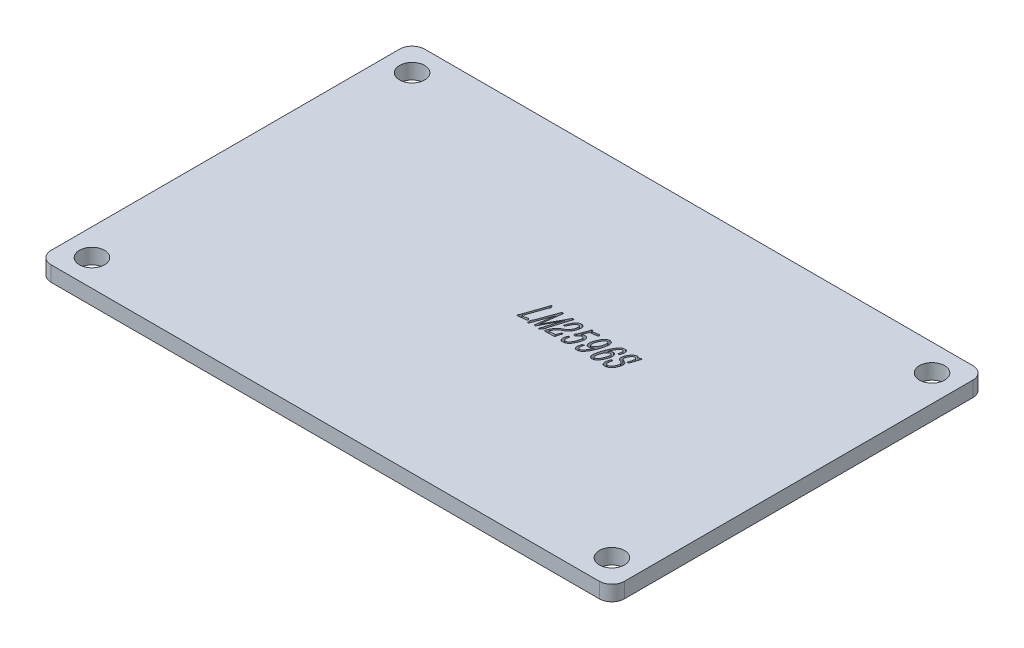
from build123d import *

# Parameters (mm, degrees)
SKETCH_1_R          = 1.65
EXTRUDE_1_DEPTH     = 2
CUT_EXTRUDE_START   = -1
CUT_EXTRUDE_1_DEPTH = 1


# Read off the part's stored shape, not the designer's step: 切除-拉伸1
with BuildPart() as part:
    # 草图1 → 凸台-拉伸1 (new body)
    with BuildSketch(Plane(origin=(0, 0, 0), x_dir=(1, 0, 0), z_dir=(0, 1, 0))):
        with BuildLine():
            Line((35.95, -24.5), (-35.95, -24.5))
            ThreePointArc((-35.95, -24.5), (-37.116726189, -24.016726189), (-37.6, -22.85))
            Line((-37.6, -22.85), (-37.6, 22.85))
            ThreePointArc((-37.6, 22.85), (-37.116726189, 24.016726189), (-35.95, 24.5))
            Line((-35.95, 24.5), (35.95, 24.5))
            ThreePointArc((35.95, 24.5), (37.116726189, 24.016726189), (37.6, 22.85))
            Line((37.6, 22.85), (37.6, -22.85))
            ThreePointArc((37.6, -22.85), (37.116726189, -24.016726189), (35.95, -24.5))
        make_face()
        with Locations(Location((-34.1, 21, 0), (0, 0, 270))):
            Circle(SKETCH_1_R, mode=Mode.SUBTRACT)
        with Locations(Location((34.1, 21, 0), (0, 0, 90))):
            Circle(SKETCH_1_R, mode=Mode.SUBTRACT)
        with Locations(Location((34.1, -21, 0), (0, 0, 270))):
            Circle(SKETCH_1_R, mode=Mode.SUBTRACT)
        with Locations(Location((-34.1, -21, 0), (0, 0, 90))):
            Circle(SKETCH_1_R, mode=Mode.SUBTRACT)
    extrude(amount=EXTRUDE_1_DEPTH)

    # 切除-拉伸1 outline → 切除-拉伸1 (cut)
    # profile 1 of 7: a face of its own
    with BuildSketch(Plane(origin=(0, 2, 0), x_dir=(1, 0, 0), z_dir=(0, 1, 0)).offset(CUT_EXTRUDE_START)):
        with BuildLine():
            add(Edge.make_bspline(
                [(11.319624973, 2.529725123), (11.326753338, 2.567830624), (11.339981513, 2.638543373), (11.363810052, 2.738810386), (11.386747264, 2.83309971), (11.402493277, 2.928406503), (11.408788686, 3.024022456), (11.40107061, 3.101456515), (11.384715065, 3.156938358), (11.369804851, 3.194089384), (11.348293758, 3.225207318), (11.322963493, 3.250684221), (11.294296694, 3.270288272), (11.263524636, 3.284015152), (11.230211949, 3.291074833), (11.184684427, 3.290006717), (11.129135658, 3.280496298), (11.076013715, 3.25837237), (11.034406929, 3.229718869), (10.996101664, 3.199008787), (10.95262477, 3.156252878), (10.901523079, 3.105345591), (10.847119389, 3.043543935), (10.792558439, 2.971198575), (10.736915044, 2.889534868), (10.664019856, 2.766635878), (10.576158329, 2.602847504), (10.499771775, 2.433051534), (10.445727973, 2.301323215), (10.421585689, 2.239116022), (10.410345271, 2.210525074)],
                knots=[0, 0, 0, 0, 0.048016888, 0.089105405, 0.127654772, 0.168210064, 0.208611881, 0.246125029, 0.263765638, 0.280183723, 0.295474126, 0.310282398, 0.324462469, 0.338252576, 0.351782306, 0.366256964, 0.394408992, 0.421179489, 0.436725185, 0.456877911, 0.481929832, 0.512200465, 0.546242109, 0.583815889, 0.624389886, 0.668597469, 0.76077153, 0.854490538, 0.899099648, 0.93715592, 0.93715592, 0.93715592, 0.93715592], degree=3))
            Line((11.319624973, 2.529725123), (11.486682293, 2.553590454))
            Line((11.486682293, 2.553590454), (11.542616663, 2.577455785))
            Line((11.542616663, 2.577455785), (11.59705945, 2.735563605))
            add(Edge.make_bspline(
                [(11.300980183, 3.558171745), (11.332938296, 3.55537961), (11.391604224, 3.55025405), (11.470752634, 3.530082967), (11.533066183, 3.499358127), (11.576123996, 3.457009642), (11.604543879, 3.412414193), (11.628279189, 3.371220088), (11.645918441, 3.332653625), (11.656575541, 3.294841352), (11.663922251, 3.255421395), (11.665904063, 3.210409655), (11.667264725, 3.158391127), (11.663279952, 3.101732242), (11.660194196, 3.045264039), (11.655589125, 2.993299452), (11.650667761, 2.948240187), (11.642153035, 2.894323663), (11.626748851, 2.823432882), (11.607663016, 2.766946106), (11.59705945, 2.735563605)],
                knots=[0, 0, 0, 0, 0.091586168, 0.168125935, 0.232336966, 0.287622003, 0.338278218, 0.383145194, 0.423552602, 0.459085297, 0.495189033, 0.537922916, 0.587673765, 0.643887342, 0.700141333, 0.749361491, 0.792995872, 0.829682411, 0.905376226, 1, 1, 1, 1], degree=3))
            add(Edge.make_bspline(
                [(10.078627743, 2.088962284), (10.092043775, 2.124514194), (10.117212009, 2.191208933), (10.152737815, 2.284990134), (10.185663794, 2.365405537), (10.225197569, 2.458460171), (10.279164702, 2.571015442), (10.346529938, 2.7098071), (10.422825779, 2.84851108), (10.4891655, 2.962189864), (10.547655064, 3.05014134), (10.597371436, 3.11763489), (10.654008389, 3.186987801), (10.714203242, 3.258491084), (10.779252353, 3.326433394), (10.846166624, 3.388282473), (10.915212273, 3.440367594), (10.984767437, 3.48551032), (11.058000786, 3.520567517), (11.135394035, 3.544224908), (11.216917438, 3.558489113), (11.272581603, 3.55827896), (11.300980183, 3.558171745)],
                knots=[0, 0, 0, 0, 0.056410835, 0.105825706, 0.14886341, 0.185400755, 0.255897094, 0.334127727, 0.414387224, 0.490842857, 0.529430594, 0.571134342, 0.615225599, 0.662339254, 0.709844425, 0.754777107, 0.797439761, 0.838085033, 0.877703722, 0.91750761, 0.957914275, 1, 1, 1, 1], degree=3))
            add(Edge.make_bspline(
                [(10.220328148, 0.281909227), (10.19249915, 0.280098745), (10.138454152, 0.276582721), (10.070837234, 0.287224422), (10.020300058, 0.307853057), (9.981584961, 0.329435729), (9.942445068, 0.358703245), (9.902806204, 0.393420868), (9.86591267, 0.435175841), (9.837901593, 0.485120934), (9.814521026, 0.539843172), (9.797351744, 0.623039326), (9.785413991, 0.73268396), (9.780797995, 0.847487699), (9.785600824, 0.948152915), (9.796865384, 1.037662616), (9.813201733, 1.140700776), (9.835695491, 1.251967632), (9.860700878, 1.361489032), (9.881452444, 1.45999998), (9.901360112, 1.541057249), (9.921795449, 1.627581379), (9.950036536, 1.724331764), (9.987162506, 1.839703457), (10.030604097, 1.961317245), (10.06209135, 2.045009175), (10.078627743, 2.088962284)],
                knots=[0, 0, 0, 0, 0.03956068, 0.07682838, 0.095843058, 0.116866224, 0.139607214, 0.165118082, 0.191658894, 0.218244295, 0.246111869, 0.275832629, 0.33841793, 0.402715898, 0.438774703, 0.481433334, 0.530775575, 0.586935239, 0.642621152, 0.690341085, 0.729908068, 0.761166336, 0.816603174, 0.872993246, 0.933298924, 1, 1, 1, 1], degree=3))
            add(Edge.make_bspline(
                [(11.068293203, 1.084380993), (11.053872372, 1.05541355), (11.023329038, 0.994060479), (10.969919402, 0.900045656), (10.909148123, 0.797266792), (10.842698841, 0.689580228), (10.77067729, 0.585020153), (10.689912589, 0.496193855), (10.604071033, 0.425272911), (10.514549478, 0.373835141), (10.428409541, 0.337241697), (10.350739054, 0.30914977), (10.282885658, 0.289066112), (10.239814747, 0.284138589), (10.220328148, 0.281909227)],
                knots=[0, 0, 0, 0, 0.079263847, 0.167880907, 0.264814542, 0.371790082, 0.477921398, 0.575347443, 0.664953156, 0.749565857, 0.827301008, 0.893958514, 0.952023584, 1, 1, 1, 1], degree=3))
            add(Edge.make_bspline(
                [(10.866929469, 2.42158534), (10.886589109, 2.42118425), (10.924292828, 2.420415029), (10.978317607, 2.413823439), (11.027127036, 2.402341257), (11.0704245, 2.384465457), (11.110126107, 2.363025804), (11.145250427, 2.334657677), (11.177822239, 2.301762803), (11.206196623, 2.262416031), (11.230840866, 2.217275717), (11.251560663, 2.166182107), (11.268932178, 2.109090825), (11.285125994, 2.024054569), (11.296537056, 1.911174741), (11.289262569, 1.794565371), (11.274634537, 1.697461188), (11.256960519, 1.617881049), (11.23389369, 1.53225165), (11.19483815, 1.411518301), (11.141690833, 1.260480826), (11.092451101, 1.142342016), (11.068293203, 1.084380993)],
                knots=[0, 0, 0, 0, 0.036382012, 0.069774277, 0.100580197, 0.128866596, 0.156266865, 0.183794371, 0.212106964, 0.241746136, 0.273258923, 0.307101626, 0.343643368, 0.383535045, 0.467197852, 0.552918689, 0.598998486, 0.648914818, 0.703726948, 0.763108811, 0.883776925, 1, 1, 1, 1], degree=3))
            add(Edge.make_bspline(
                [(10.410345271, 2.210525074), (10.416050186, 2.215819905), (10.449129723, 2.245792172), (10.515387249, 2.296635031), (10.596944633, 2.34739101), (10.669961017, 2.38141985), (10.730958103, 2.401452348), (10.797361446, 2.414729849), (10.843260597, 2.419252922), (10.866929469, 2.42158534)],
                knots=[0.404971471, 0.404971471, 0.404971471, 0.404971471, 0.432023627, 0.560128766, 0.694717093, 0.765101066, 0.83971451, 0.917345382, 1, 1, 1, 1], degree=3))
        make_face()
        with BuildLine():
            add(Edge.make_bspline(
                [(10.78340081, 2.144150863), (10.773100017, 2.142556458), (10.750618648, 2.139076688), (10.716027357, 2.124014401), (10.676728769, 2.104229335), (10.61950773, 2.068122267), (10.549209543, 2.014286204), (10.485947564, 1.949276583), (10.438225331, 1.889966685), (10.402168059, 1.836055129), (10.362124324, 1.775401551), (10.32250004, 1.70543497), (10.282350459, 1.628120598), (10.242879966, 1.544201096), (10.20537119, 1.453333549), (10.182767084, 1.390009052), (10.171105902, 1.35734072)],
                knots=[0, 0, 0, 0, 0.030109941, 0.065714622, 0.108588335, 0.157792871, 0.261597461, 0.364557771, 0.419941904, 0.482122806, 0.552499195, 0.630638236, 0.715103682, 0.805067532, 0.89943673, 1, 1, 1, 1], degree=3))
            add(Edge.make_bspline(
                [(10.994459834, 1.706371191), (10.996023434, 1.727987763), (10.999094338, 1.770442601), (10.998155227, 1.83301138), (10.993304701, 1.893197713), (10.982810117, 1.949506966), (10.969352689, 2.000724278), (10.95159455, 2.044118522), (10.930889814, 2.079967855), (10.905013561, 2.106412307), (10.876785311, 2.125274258), (10.847149319, 2.138714329), (10.815442897, 2.144403173), (10.79410278, 2.144235134), (10.78340081, 2.144150863)],
                knots=[0, 0, 0, 0, 0.117814531, 0.231387145, 0.339957123, 0.445764662, 0.542521874, 0.627383564, 0.700188791, 0.766158301, 0.826528991, 0.884046869, 0.941850039, 1, 1, 1, 1], degree=3))
            add(Edge.make_bspline(
                [(10.261346687, 0.559343703), (10.277116988, 0.561036132), (10.310050452, 0.564570469), (10.359697313, 0.581371719), (10.411370211, 0.606364875), (10.464387545, 0.639656708), (10.516258175, 0.68049559), (10.566448783, 0.725344467), (10.611522599, 0.776372283), (10.667831669, 0.851112799), (10.731329902, 0.95619793), (10.795934626, 1.094643622), (10.855107472, 1.241413379), (10.915663077, 1.390752272), (10.967307612, 1.545247184), (10.985397457, 1.652594138), (10.994459834, 1.706371191)],
                knots=[0, 0, 0, 0, 0.033065291, 0.069050969, 0.108790502, 0.152905102, 0.19956824, 0.246646067, 0.293375687, 0.341592316, 0.442107469, 0.549241177, 0.660589479, 0.772799957, 0.88618076, 1, 1, 1, 1], degree=3))
            add(Edge.make_bspline(
                [(10.171105902, 1.35734072), (10.157214891, 1.313537581), (10.128946777, 1.22439849), (10.099911739, 1.087160277), (10.082936778, 0.949425392), (10.081717538, 0.837543122), (10.089357472, 0.754881106), (10.09924336, 0.701098577), (10.115046922, 0.655622102), (10.133766577, 0.617106754), (10.158955138, 0.587815623), (10.18889873, 0.567377888), (10.224199621, 0.557126412), (10.248618264, 0.55858395), (10.261346687, 0.559343703)],
                knots=[0, 0, 0, 0, 0.152325287, 0.309980926, 0.464393534, 0.611968529, 0.679892627, 0.739554139, 0.792740957, 0.839202455, 0.880695047, 0.919337794, 0.957954149, 1, 1, 1, 1], degree=3))
        make_face(mode=Mode.SUBTRACT)
    # profile 2 of 7: a face of its own
    with BuildSketch(Plane(origin=(0, 2, 0), x_dir=(1, 0, 0), z_dir=(0, 1, 0)).offset(CUT_EXTRUDE_START)):
        with BuildLine():
            add(Edge.make_bspline(
                [(12.912635841, 3.567867036), (12.939142799, 3.565233706), (12.990134196, 3.560167972), (13.061479373, 3.539212889), (13.125736341, 3.511504093), (13.179321881, 3.472634465), (13.224573033, 3.431830655), (13.258620007, 3.394250591), (13.275885689, 3.369629077), (13.28190395, 3.359344784)],
                knots=[0, 0, 0, 0, 0.160913397, 0.309548871, 0.448301289, 0.582320695, 0.708056454, 0.8167907, 0.888918404, 0.888918404, 0.888918404, 0.888918404], degree=3))
            add(Edge.make_bspline(
                [(12.028872789, 2.730343064), (12.037961875, 2.756585471), (12.05554781, 2.807360352), (12.086989767, 2.878979592), (12.11750693, 2.945449357), (12.162163511, 3.025869263), (12.224268655, 3.12064819), (12.306016893, 3.227829835), (12.393614077, 3.323941803), (12.484290088, 3.405999762), (12.578963013, 3.471260438), (12.661240331, 3.516590821), (12.73159073, 3.543940104), (12.788797484, 3.557595487), (12.849411885, 3.567266944), (12.891215329, 3.567663723), (12.912635841, 3.567867036)],
                knots=[0, 0, 0, 0, 0.064498195, 0.12479374, 0.181637338, 0.234373753, 0.338350867, 0.444636662, 0.547250782, 0.640116115, 0.728083073, 0.81387459, 0.857749845, 0.902998931, 0.950295664, 1, 1, 1, 1], degree=3))
            add(Edge.make_bspline(
                [(12.213829107, 1.920413382), (12.18380199, 1.935425676), (12.124665966, 1.964991197), (12.061289845, 2.0182297), (12.019942917, 2.06725959), (11.994543204, 2.10732764), (11.973202676, 2.150129614), (11.957629324, 2.196825794), (11.947181788, 2.247139404), (11.942356007, 2.301149805), (11.941503127, 2.358766382), (11.94621769, 2.42089776), (11.956966845, 2.488708612), (11.974384709, 2.5631426), (11.998467725, 2.64475035), (12.018397516, 2.700854323), (12.028872789, 2.730343064)],
                knots=[0, 0, 0, 0, 0.107404064, 0.211523776, 0.262460483, 0.312661898, 0.363291962, 0.415479857, 0.470049255, 0.527721881, 0.589115285, 0.654664533, 0.727279933, 0.809086455, 0.899654161, 1, 1, 1, 1], degree=3))
            Line((12.213829107, 1.920413382), (12.398039633, 1.841359472))
            add(Edge.make_bspline(
                [(12.585233326, 1.240251438), (12.594400313, 1.274448647), (12.611296104, 1.33747796), (12.62795106, 1.425432934), (12.636008327, 1.498379763), (12.633269717, 1.558239262), (12.622779176, 1.608147262), (12.608581966, 1.652170455), (12.587575031, 1.690922305), (12.562719839, 1.726194961), (12.531116406, 1.757888149), (12.493380693, 1.787946863), (12.448445071, 1.816124798), (12.415345898, 1.832695368), (12.398039633, 1.841359472)],
                knots=[0, 0, 0, 0, 0.149796169, 0.276091238, 0.378589772, 0.459715849, 0.528429664, 0.593977199, 0.65469369, 0.714259707, 0.776015707, 0.843387247, 0.918113307, 1, 1, 1, 1], degree=3))
            add(Edge.make_bspline(
                [(11.931174089, 0.574259535), (11.95160895, 0.574956763), (11.991801323, 0.576328107), (12.050331783, 0.58771282), (12.10533799, 0.6066983), (12.15778136, 0.632425154), (12.207284117, 0.665796263), (12.256453349, 0.704089904), (12.304001843, 0.748899201), (12.363583365, 0.815241572), (12.430281098, 0.898970165), (12.494124356, 1.005113843), (12.545134858, 1.117985543), (12.571358469, 1.197945037), (12.585233326, 1.240251438)],
                knots=[0, 0, 0, 0, 0.06157663, 0.121112194, 0.178948509, 0.236604839, 0.296685232, 0.358612133, 0.424367126, 0.493341319, 0.627383728, 0.746417103, 0.865829817, 1, 1, 1, 1], degree=3))
            add(Edge.make_bspline(
                [(11.776795227, 1.46398892), (11.768461383, 1.425980908), (11.752797092, 1.354541058), (11.732683638, 1.253544708), (11.716322288, 1.165770154), (11.699399386, 1.069455772), (11.687113395, 0.964430817), (11.688733634, 0.867064956), (11.697142974, 0.79769926), (11.708995673, 0.75251395), (11.722406268, 0.711364334), (11.740619482, 0.675611471), (11.760390674, 0.644836582), (11.782109829, 0.620379129), (11.803881566, 0.600607911), (11.835200511, 0.58383917), (11.878312409, 0.573425255), (11.913231895, 0.573976366), (11.931174089, 0.574259535)],
                knots=[0, 0, 0, 0, 0.112864024, 0.212139198, 0.298694179, 0.371837857, 0.495825715, 0.604731979, 0.653479027, 0.698076056, 0.740035884, 0.7787337, 0.814133331, 0.845812142, 0.873421557, 0.898915982, 0.948061405, 1, 1, 1, 1], degree=3))
            Line((11.776795227, 1.46398892), (11.570956744, 1.46398892))
            Line((11.570956744, 1.46398892), (11.482207543, 1.151502237))
            add(Edge.make_bspline(
                [(11.846153846, 0.291604517), (11.821507506, 0.291672515), (11.774402182, 0.291802474), (11.707229629, 0.302668781), (11.647908365, 0.323792617), (11.596166803, 0.353871173), (11.552693807, 0.393226045), (11.514008461, 0.437883281), (11.483088935, 0.490364957), (11.45641734, 0.548064989), (11.437405549, 0.612114312), (11.425614494, 0.681715451), (11.420595756, 0.756164709), (11.423124823, 0.861840183), (11.43937617, 0.995682807), (11.468003001, 1.099826479), (11.482207543, 1.151502237)],
                knots=[0, 0, 0, 0, 0.066209553, 0.126543031, 0.181941951, 0.234679622, 0.286308345, 0.338948483, 0.392946326, 0.449486953, 0.509545765, 0.57196873, 0.638979959, 0.709851081, 0.856029028, 1, 1, 1, 1], degree=3))
            add(Edge.make_bspline(
                [(12.716492649, 0.886746218), (12.690673631, 0.843535161), (12.639155802, 0.757314228), (12.560012956, 0.660765442), (12.494157344, 0.590048647), (12.446439371, 0.542235389), (12.400473609, 0.499550612), (12.354670103, 0.462173232), (12.307160045, 0.427820804), (12.25390394, 0.397983566), (12.195658355, 0.36856258), (12.132248815, 0.342013207), (12.064574224, 0.319473968), (11.993939972, 0.303210907), (11.920780395, 0.293064213), (11.871295667, 0.292096292), (11.846153846, 0.291604517)],
                knots=[0, 0, 0, 0, 0.136340092, 0.272045418, 0.337393071, 0.398407192, 0.455181305, 0.507402547, 0.558653188, 0.613922574, 0.672710074, 0.735558621, 0.800150866, 0.865886795, 0.931860792, 1, 1, 1, 1], degree=3))
            add(Edge.make_bspline(
                [(12.603878116, 2.121777115), (12.625624731, 2.110055924), (12.666928449, 2.087793665), (12.723661478, 2.052989545), (12.771789988, 2.018606704), (12.823834543, 1.974915948), (12.876279106, 1.915606015), (12.913094756, 1.847682595), (12.93267358, 1.790038621), (12.943825739, 1.74470064), (12.947642368, 1.696750531), (12.947439011, 1.629122814), (12.93803875, 1.540489915), (12.922539072, 1.449199842), (12.903377024, 1.372394865), (12.887292499, 1.308688575), (12.865934129, 1.241147333), (12.835749131, 1.144635294), (12.79080682, 1.023351055), (12.741226002, 0.932211244), (12.716492649, 0.886746218)],
                knots=[0, 0, 0, 0, 0.051978856, 0.098724335, 0.139954766, 0.176325786, 0.241579757, 0.305248117, 0.337342347, 0.369572714, 0.403199264, 0.438248371, 0.511800373, 0.590407898, 0.632912887, 0.678337143, 0.72864387, 0.781914954, 0.891208439, 1, 1, 1, 1], degree=3))
            Line((12.603878116, 2.121777115), (12.451736629, 2.191881526))
            add(Edge.make_bspline(
                [(12.251864479, 2.420839548), (12.25546024, 2.402259087), (12.262116354, 2.367864795), (12.280672021, 2.321957054), (12.302840436, 2.284124567), (12.341964771, 2.250166174), (12.392119568, 2.220779682), (12.432728901, 2.201095135), (12.451736629, 2.191881526)],
                knots=[0, 0, 0, 0, 0.175867707, 0.325548712, 0.459851584, 0.579514817, 0.803186428, 1, 1, 1, 1], degree=3))
            add(Edge.make_bspline(
                [(12.827615598, 3.290432559), (12.817908102, 3.289873934), (12.796811475, 3.288659913), (12.768800737, 3.283484538), (12.742880056, 3.273587179), (12.717635925, 3.261203579), (12.687516093, 3.243071278), (12.638434899, 3.211799257), (12.573729795, 3.160269146), (12.503974029, 3.081081866), (12.440608573, 2.992377615), (12.393744172, 2.913555877), (12.361985839, 2.845783376), (12.33736252, 2.789834611), (12.312076152, 2.727980931), (12.287128503, 2.662429917), (12.266514629, 2.596339869), (12.252249856, 2.533358423), (12.24732849, 2.475025625), (12.250408657, 2.438230529), (12.251864479, 2.420839548)],
                knots=[0, 0, 0, 0, 0.02615902, 0.056849589, 0.07610501, 0.100631584, 0.132403363, 0.17061691, 0.257201114, 0.353786648, 0.453453338, 0.550260886, 0.599916659, 0.654714876, 0.714699339, 0.779666327, 0.843339964, 0.900791803, 0.953109843, 1, 1, 1, 1], degree=3))
            add(Edge.make_bspline(
                [(13.052844662, 2.761666312), (13.058173498, 2.789455577), (13.067940833, 2.840391112), (13.076337384, 2.910439693), (13.082173791, 2.966656911), (13.080289229, 3.022987276), (13.06815402, 3.08223188), (13.044263646, 3.146477292), (13.006166289, 3.203274921), (12.955389906, 3.248171568), (12.895185746, 3.281983749), (12.850160063, 3.287613653), (12.827615598, 3.290432559)],
                knots=[0, 0, 0, 0, 0.128213972, 0.235006107, 0.319796701, 0.384071856, 0.489716169, 0.592471914, 0.693117255, 0.796064391, 0.897888965, 1, 1, 1, 1], degree=3))
            Line((13.052844662, 2.761666312), (12.895482634, 2.19859365))
            Line((12.895482634, 2.19859365), (13.099083742, 2.211272107))
            Line((13.099083742, 2.211272107), (13.553270829, 3.524611123))
            Line((13.553270829, 3.524611123), (13.373535052, 3.539526955))
            Line((13.373535052, 3.539526955), (13.28190395, 3.359344784))
        make_face()
    # profile 3 of 7: a face of its own
    with BuildSketch(Plane(origin=(0, 2, 0), x_dir=(1, 0, 0), z_dir=(0, 1, 0)).offset(CUT_EXTRUDE_START)):
        with BuildLine():
            add(Edge.make_bspline(
                [(4.518751332, 2.1941189), (4.52742417, 2.224704013), (4.543586905, 2.281702542), (4.56654992, 2.361132264), (4.587435472, 2.42793498), (4.611929362, 2.503501881), (4.646526277, 2.594316086), (4.67664378, 2.666295228), (4.692520776, 2.704240358)],
                knots=[0, 0, 0, 0, 0.176806308, 0.329496897, 0.459810584, 0.566052454, 0.77123656, 1, 1, 1, 1], degree=3))
            Line((4.518751332, 2.1941189), (4.694012359, 2.217984232))
            Line((4.694012359, 2.217984232), (4.748455146, 2.241103772))
            Line((4.748455146, 2.241103772), (4.808118474, 2.402194758))
            add(Edge.make_bspline(
                [(5.501704667, 3.241210313), (5.482379308, 3.240757185), (5.439944116, 3.239762191), (5.374292699, 3.21333138), (5.303012143, 3.170582731), (5.227738787, 3.109611004), (5.150875726, 3.032289377), (5.078006004, 2.936860027), (5.006798145, 2.824648378), (4.936411066, 2.696335254), (4.86826172, 2.554061095), (4.828402329, 2.453413057), (4.808118474, 2.402194758)],
                knots=[0, 0, 0, 0, 0.050563255, 0.111028292, 0.18322451, 0.269416453, 0.365243966, 0.469747148, 0.584883573, 0.714985691, 0.85496043, 1, 1, 1, 1], degree=3))
            add(Edge.make_bspline(
                [(5.700085233, 2.843703388), (5.702760308, 2.870021391), (5.707874552, 2.920336507), (5.70832801, 2.99333408), (5.700560048, 3.059541133), (5.688387067, 3.11918998), (5.665665647, 3.172021345), (5.623381091, 3.210604938), (5.567076911, 3.234856875), (5.524595988, 3.238985537), (5.501704667, 3.241210313)],
                knots=[0, 0, 0, 0, 0.154058382, 0.294530913, 0.424229108, 0.541566664, 0.649092709, 0.752563447, 0.866666044, 1, 1, 1, 1], degree=3))
            add(Edge.make_bspline(
                [(5.119113573, 1.891327509), (5.137899638, 1.901021344), (5.174046093, 1.919673349), (5.223813272, 1.950516435), (5.268579282, 1.980772805), (5.308239823, 2.014571505), (5.347364494, 2.053553536), (5.387403985, 2.102337589), (5.429373945, 2.162612276), (5.490308836, 2.254276533), (5.559846289, 2.376167772), (5.624751363, 2.528763989), (5.6732433, 2.683894653), (5.691103931, 2.790231434), (5.700085233, 2.843703388)],
                knots=[0, 0, 0, 0, 0.05476668, 0.105377116, 0.151669174, 0.194650271, 0.240210143, 0.294657526, 0.357948043, 0.430501334, 0.579948825, 0.72081211, 0.859609046, 1, 1, 1, 1], degree=3))
            Line((5.119113573, 1.891327509), (4.873002344, 1.763051353))
            add(Edge.make_bspline(
                [(4.026528873, 0.838269763), (4.053436719, 0.893321497), (4.104223711, 0.99722844), (4.186161234, 1.13827915), (4.266099643, 1.256681798), (4.346582779, 1.351995827), (4.424112839, 1.429631638), (4.494949772, 1.497370541), (4.560862148, 1.554686162), (4.642469506, 1.617984485), (4.745186989, 1.687597609), (4.829968468, 1.737646995), (4.873002344, 1.763051353)],
                knots=[0, 0, 0, 0, 0.143839333, 0.271488367, 0.382722806, 0.478837322, 0.563869028, 0.640256739, 0.708952998, 0.768852387, 0.882672751, 1, 1, 1, 1], degree=3))
            add(Edge.make_bspline(
                [(3.969848711, 0.331131472), (3.958861911, 0.330771559), (3.939028006, 0.330121826), (3.912017273, 0.337515829), (3.891466092, 0.352157542), (3.880298429, 0.376235534), (3.878830794, 0.407793192), (3.882801393, 0.448523238), (3.89595605, 0.499146405), (3.921493786, 0.582842534), (3.965870906, 0.697211517), (4.00584785, 0.790176677), (4.026528873, 0.838269763)],
                knots=[0, 0, 0, 0, 0.055062309, 0.09940116, 0.138686278, 0.177851686, 0.228145004, 0.295993015, 0.383390618, 0.490642207, 0.736497112, 1, 1, 1, 1], degree=3))
            Line((3.969848711, 0.331131472), (4.955785212, 0.355742595))
            add(Edge.make_bspline(
                [(5.265288728, 0.553377371), (5.261278348, 0.539966515), (5.254294301, 0.516611612), (5.245518009, 0.485792342), (5.238170034, 0.465080135), (5.231479678, 0.446252079), (5.213569852, 0.425065122), (5.193249486, 0.396911338), (5.156182621, 0.373587741), (5.105742147, 0.364690038), (5.037665859, 0.35589756), (4.98518622, 0.355798239), (4.955785212, 0.355742595)],
                knots=[0, 0, 0, 0, 0.100483591, 0.174991401, 0.22972114, 0.258544779, 0.317448375, 0.426207677, 0.506394728, 0.62409379, 0.789403632, 1, 1, 1, 1], degree=3))
            Line((5.265288728, 0.553377371), (5.480822502, 1.251438312))
            Line((5.480822502, 1.251438312), (5.273492436, 1.251438312))
            Line((5.273492436, 1.251438312), (5.091519284, 0.786064351))
            add(Edge.make_bspline(
                [(5.012465374, 0.642872363), (5.015280268, 0.643394819), (5.020563987, 0.6443755), (5.028521261, 0.650370967), (5.034430882, 0.666113687), (5.04811039, 0.691825755), (5.067938047, 0.733654665), (5.082897328, 0.766901914), (5.091519284, 0.786064351)],
                knots=[0, 0, 0, 0, 0.050886524, 0.095516957, 0.171388695, 0.345046395, 0.622509892, 1, 1, 1, 1], degree=3))
            Line((5.012465374, 0.642872363), (4.21595994, 0.614532282))
            Line((4.21595994, 0.614532282), (4.280098018, 0.772640102))
            add(Edge.make_bspline(
                [(4.915512465, 1.508736416), (4.886179417, 1.492742657), (4.827048838, 1.460501882), (4.742868179, 1.40457342), (4.662415969, 1.34381028), (4.591968595, 1.273672462), (4.528541807, 1.198981821), (4.468398884, 1.120471794), (4.412177336, 1.03414168), (4.359633601, 0.943454614), (4.313400772, 0.85614754), (4.29038255, 0.798428807), (4.280098018, 0.772640102)],
                knots=[0, 0, 0, 0, 0.100736605, 0.203068347, 0.304619499, 0.404315168, 0.502166149, 0.60010617, 0.702437912, 0.812664409, 0.91629854, 1, 1, 1, 1], degree=3))
            Line((4.915512465, 1.508736416), (5.22427019, 1.668335819))
            add(Edge.make_bspline(
                [(5.814191349, 2.308970808), (5.791326086, 2.265279153), (5.74440479, 2.175620482), (5.660051753, 2.049790865), (5.569560284, 1.933450682), (5.486922509, 1.848915338), (5.415063521, 1.792483145), (5.357403798, 1.750233432), (5.293240909, 1.7087072), (5.247746119, 1.68207724), (5.22427019, 1.668335819)],
                knots=[0, 0, 0, 0, 0.166927441, 0.34254808, 0.512188802, 0.665802747, 0.741285181, 0.821454804, 0.907868257, 1, 1, 1, 1], degree=3))
            add(Edge.make_bspline(
                [(5.599403367, 3.538781163), (5.621606813, 3.537117835), (5.664163567, 3.533929778), (5.724784762, 3.520095975), (5.77974091, 3.500313212), (5.828236662, 3.473041702), (5.871005934, 3.441647552), (5.907828012, 3.406681898), (5.938077474, 3.367773107), (5.963172818, 3.325862973), (5.98165253, 3.278828985), (5.996994737, 3.227832865), (6.005073695, 3.171067425), (6.012231251, 3.090010012), (6.009783094, 2.984777885), (5.991678271, 2.856561809), (5.960244821, 2.722605303), (5.919428998, 2.582902167), (5.872535809, 2.44222348), (5.833237055, 2.352469217), (5.814191349, 2.308970808)],
                knots=[0, 0, 0, 0, 0.044636197, 0.085553007, 0.124390622, 0.161466956, 0.196796398, 0.230676006, 0.263017811, 0.295451868, 0.328347086, 0.364194254, 0.402094164, 0.443159791, 0.527501624, 0.612607545, 0.702668551, 0.803424088, 0.90473166, 1, 1, 1, 1], degree=3))
            add(Edge.make_bspline(
                [(4.692520776, 2.704240358), (4.704829383, 2.733376157), (4.728738936, 2.789972648), (4.765412737, 2.871250639), (4.804124408, 2.945167471), (4.842430538, 3.015645801), (4.887979964, 3.083425056), (4.941301867, 3.153346275), (5.005153812, 3.226019045), (5.075500384, 3.300468462), (5.149721381, 3.37039397), (5.225927168, 3.427121407), (5.299901943, 3.471287233), (5.372992327, 3.498431741), (5.440596807, 3.514994961), (5.500260261, 3.529354022), (5.552450691, 3.537226083), (5.58471661, 3.538294735), (5.599403367, 3.538781163)],
                knots=[0, 0, 0, 0, 0.072714776, 0.141248954, 0.204893109, 0.264509684, 0.325534037, 0.392401429, 0.466539591, 0.547790467, 0.627869174, 0.700563736, 0.765849414, 0.825180425, 0.878964782, 0.925827397, 0.966238217, 1, 1, 1, 1], degree=3))
        make_face()
    # profile 4 of 7: a face of its own
    with BuildSketch(Plane(origin=(0, 2, 0), x_dir=(1, 0, 0), z_dir=(0, 1, 0)).offset(CUT_EXTRUDE_START)):
        with BuildLine():
            add(Edge.make_bspline(
                [(3.759535478, 1.011293416), (3.754922021, 0.998411394), (3.74635742, 0.974496709), (3.736445384, 0.940605878), (3.726816458, 0.912364054), (3.719112619, 0.881013608), (3.713109845, 0.845126386), (3.707546363, 0.804614334), (3.706058766, 0.766926656), (3.707628046, 0.734019354), (3.710731277, 0.705928575), (3.710755684, 0.681837677), (3.700151773, 0.65791386), (3.682268159, 0.628493151), (3.65475747, 0.586082516), (3.632149433, 0.554268415), (3.619326657, 0.536224164)],
                knots=[0, 0, 0, 0, 0.080753431, 0.149913804, 0.20839393, 0.25679974, 0.340280675, 0.42310116, 0.498002039, 0.562639444, 0.617115751, 0.66563266, 0.701877649, 0.769590465, 0.869316836, 1, 1, 1, 1], degree=3))
            Line((3.759535478, 1.011293416), (3.828894098, 1.229064564))
            Line((3.828894098, 1.229064564), (4.577668869, 3.593969742))
            Line((4.577668869, 3.593969742), (4.332303431, 3.593969742))
            Line((4.332303431, 3.593969742), (2.815363307, 0.797251225))
            Line((2.815363307, 0.797251225), (3.200191775, 3.593969742))
            Line((3.200191775, 3.593969742), (2.951097379, 3.593969742))
            Line((2.951097379, 3.593969742), (2.087470701, 1.20370765))
            add(Edge.make_bspline(
                [(1.799595142, 0.566055828), (1.801478516, 0.581109529), (1.805173922, 0.610646704), (1.821543585, 0.653578281), (1.845429282, 0.696107861), (1.875545933, 0.736707605), (1.901000571, 0.773152741), (1.921166344, 0.796774711), (1.931063669, 0.815674908), (1.941339048, 0.833170877), (1.950847183, 0.858589935), (1.964007402, 0.887240928), (1.975192454, 0.917106232), (1.986828891, 0.942058714), (1.994834316, 0.961643085), (2.000845452, 0.975295176), (2.006468186, 0.986958971), (2.010972758, 1.001370544), (2.020147647, 1.020673065), (2.028983008, 1.046375699), (2.040498312, 1.077755243), (2.054689916, 1.114356101), (2.070250625, 1.157244706), (2.081484634, 1.187556135), (2.087470701, 1.20370765)],
                knots=[0, 0, 0, 0, 0.064362733, 0.126287432, 0.194015174, 0.271510944, 0.341137925, 0.383462597, 0.40288704, 0.431768008, 0.469698212, 0.518048477, 0.565991795, 0.60531333, 0.635185225, 0.656027709, 0.668812983, 0.690238215, 0.72011011, 0.759616287, 0.805811297, 0.862408184, 0.926683881, 1, 1, 1, 1], degree=3))
            Line((1.799595142, 0.566055828), (1.811527807, 0.348284679))
            add(Edge.make_bspline(
                [(1.857766887, 0.198380567), (1.851709489, 0.199225064), (1.838525031, 0.201063186), (1.822736888, 0.211024146), (1.814233273, 0.226009088), (1.80992754, 0.242607416), (1.808149201, 0.263963083), (1.808153466, 0.288405989), (1.810231987, 0.311719688), (1.8103767, 0.330155913), (1.811603477, 0.341561625), (1.811544602, 0.346792507), (1.811527807, 0.348284679)],
                knots=[0, 0, 0, 0, 0.103457675, 0.225184737, 0.299006802, 0.391175757, 0.514212532, 0.661916962, 0.805649294, 0.911236827, 0.974679241, 1, 1, 1, 1], degree=3))
            add(Edge.make_bspline(
                [(2.066588536, 0.401981675), (2.057289988, 0.378448997), (2.038176198, 0.330075993), (2.007974543, 0.272172839), (1.975065965, 0.230566669), (1.9416431, 0.209155613), (1.901537391, 0.197425234), (1.873012571, 0.198047815), (1.857766887, 0.198380567)],
                knots=[0, 0, 0, 0, 0.238225779, 0.489689114, 0.612577651, 0.732692637, 0.85713202, 1, 1, 1, 1], degree=3))
            Line((2.066588536, 0.401981675), (2.181440443, 0.707756233))
            Line((2.181440443, 0.707756233), (2.933198381, 2.796718517))
            Line((2.933198381, 2.796718517), (2.552098871, 0.322927765))
            Line((2.552098871, 0.322927765), (2.76539527, 0.31621564))
            Line((2.76539527, 0.31621564), (4.072767952, 2.826550181))
            Line((4.072767952, 2.826550181), (3.391860217, 0.733113147))
            Line((3.391860217, 0.733113147), (3.2956531, 0.427338589))
            add(Edge.make_bspline(
                [(3.244939271, 0.252077562), (3.244076606, 0.259799804), (3.241797935, 0.280197582), (3.251889389, 0.317902753), (3.270134432, 0.368247272), (3.286452101, 0.406032651), (3.2956531, 0.427338589)],
                knots=[0, 0, 0, 0, 0.125565402, 0.331672527, 0.62315202, 1, 1, 1, 1], degree=3))
            add(Edge.make_bspline(
                [(3.505966333, 0.367675261), (3.494455365, 0.352371298), (3.473086616, 0.323961301), (3.441222414, 0.286856075), (3.413111385, 0.257719643), (3.380532249, 0.232438728), (3.340231313, 0.213403669), (3.298816062, 0.211295154), (3.271163782, 0.218107417), (3.255222616, 0.225191195), (3.245742075, 0.237650105), (3.245209847, 0.24721496), (3.244939271, 0.252077562)],
                knots=[0, 0, 0, 0, 0.167159473, 0.310311779, 0.426966479, 0.519877317, 0.66953105, 0.808609623, 0.871260354, 0.917867672, 0.958245383, 1, 1, 1, 1], degree=3))
            Line((3.505966333, 0.367675261), (3.619326657, 0.536224164))
        make_face()
    # profile 5 of 7: a face of its own
    with BuildSketch(Plane(origin=(0, 2, 0), x_dir=(1, 0, 0), z_dir=(0, 1, 0)).offset(CUT_EXTRUDE_START)):
        with BuildLine():
            add(Edge.make_bspline(
                [(8.173130194, 1.330492222), (8.166894798, 1.308621546), (8.155069895, 1.267145657), (8.138549738, 1.208008235), (8.124438148, 1.155602287), (8.108655453, 1.092787365), (8.094295896, 1.01296145), (8.080777408, 0.913586682), (8.079345091, 0.811612797), (8.09436686, 0.730672762), (8.11429414, 0.673670829), (8.132475538, 0.637579853), (8.152126106, 0.606758143), (8.175038714, 0.581792848), (8.201963299, 0.56321907), (8.232933859, 0.551493521), (8.267583981, 0.545446051), (8.318167708, 0.546039829), (8.382422177, 0.559227076), (8.445312536, 0.58461919), (8.495638299, 0.616263735), (8.537811208, 0.651702113), (8.586463067, 0.695589767), (8.639578203, 0.749800444), (8.695930399, 0.813291133), (8.752541297, 0.886492586), (8.808448958, 0.969303025), (8.88490698, 1.093203941), (8.976387241, 1.264043175), (9.040871557, 1.407885921), (9.074046452, 1.481887918)],
                knots=[0, 0, 0, 0, 0.031366226, 0.059483398, 0.084683528, 0.106221462, 0.148788073, 0.196461362, 0.24446272, 0.288777514, 0.309165842, 0.327566008, 0.344397941, 0.359437255, 0.373987904, 0.38907794, 0.404748868, 0.422235077, 0.458546602, 0.494521488, 0.515164806, 0.540278486, 0.570376649, 0.605531788, 0.644882388, 0.687403406, 0.733051076, 0.782624689, 0.888168104, 1, 1, 1, 1], degree=3))
            Line((8.173130194, 1.330492222), (8.052311954, 1.306626891))
            Line((8.052311954, 1.306626891), (7.948646921, 1.28276156))
            Line((7.948646921, 1.28276156), (7.912103132, 1.178350735))
            add(Edge.make_bspline(
                [(8.181333902, 0.286383976), (8.160873666, 0.287822735), (8.121073492, 0.290621473), (8.063836046, 0.303910993), (8.010486217, 0.322243319), (7.961800028, 0.347319489), (7.91916732, 0.379912558), (7.883330414, 0.419807162), (7.856737613, 0.46805384), (7.836253817, 0.522255179), (7.824358058, 0.583244383), (7.817712204, 0.649658727), (7.817279749, 0.721767588), (7.822556648, 0.799812335), (7.834986598, 0.884454896), (7.853510647, 0.976180713), (7.880369844, 1.07491894), (7.901215147, 1.142862327), (7.912103132, 1.178350735)],
                knots=[0, 0, 0, 0, 0.055007551, 0.107003176, 0.15725938, 0.206235332, 0.253374724, 0.300669887, 0.349115068, 0.400455005, 0.455713199, 0.515437444, 0.579535696, 0.649128809, 0.725326228, 0.809126768, 0.900302481, 1, 1, 1, 1], degree=3))
            add(Edge.make_bspline(
                [(9.461858087, 1.745898146), (9.437367071, 1.686682548), (9.390532213, 1.573442898), (9.321311486, 1.411437627), (9.25371891, 1.264199023), (9.18657859, 1.127125985), (9.11420762, 0.995163941), (9.032593366, 0.862601406), (8.935141185, 0.726523616), (8.840844669, 0.614405932), (8.758924109, 0.527647508), (8.696631832, 0.470249327), (8.634993239, 0.422182706), (8.573617605, 0.384154216), (8.514321783, 0.354365245), (8.458174476, 0.330513933), (8.405641947, 0.311218653), (8.341350994, 0.296181818), (8.266947717, 0.286024043), (8.208956603, 0.286267846), (8.181333902, 0.286383976)],
                knots=[0, 0, 0, 0, 0.0933016, 0.17842327, 0.256488765, 0.329170216, 0.400608986, 0.475541244, 0.555697532, 0.644076035, 0.68862185, 0.729356176, 0.767292738, 0.802245569, 0.834296723, 0.863811269, 0.891056859, 0.915638031, 0.959816163, 1, 1, 1, 1], degree=3))
            add(Edge.make_bspline(
                [(9.261240145, 3.553696996), (9.291138462, 3.554025011), (9.350785323, 3.5546794), (9.424880873, 3.539360924), (9.482508723, 3.517729969), (9.526098291, 3.494465131), (9.56876625, 3.463128103), (9.61086121, 3.425764639), (9.649914849, 3.381452303), (9.681751898, 3.329112684), (9.704592363, 3.26961564), (9.724152634, 3.183128611), (9.738488832, 3.072680666), (9.745098542, 2.960108041), (9.742249078, 2.864130153), (9.732826633, 2.77917685), (9.715901538, 2.680496764), (9.693248522, 2.573330173), (9.670112114, 2.467114322), (9.646931591, 2.372205518), (9.629208759, 2.292556291), (9.606245605, 2.205930361), (9.578594449, 2.101941398), (9.53923425, 1.978320367), (9.500013852, 1.858059652), (9.473859278, 1.781176478), (9.461858087, 1.745898146)],
                knots=[0, 0, 0, 0, 0.042022022, 0.083833538, 0.105549425, 0.128571957, 0.153152048, 0.179927571, 0.207722664, 0.236000768, 0.265709669, 0.297040815, 0.360659025, 0.422352577, 0.455626199, 0.495755141, 0.542602333, 0.596566009, 0.649991039, 0.695674037, 0.734140798, 0.764877626, 0.821863417, 0.885642275, 0.947526234, 1, 1, 1, 1], degree=3))
            add(Edge.make_bspline(
                [(8.456531004, 2.749733646), (8.470433832, 2.779943736), (8.499726641, 2.843595419), (8.551332059, 2.940867705), (8.612240745, 3.044580335), (8.679126695, 3.152026305), (8.750978569, 3.255109631), (8.829535094, 3.342667997), (8.911181915, 3.411962012), (8.995270404, 3.461574867), (9.075103662, 3.496427649), (9.14546809, 3.524845689), (9.206232133, 3.544396743), (9.244253219, 3.550825001), (9.261240145, 3.553696996)],
                knots=[0, 0, 0, 0, 0.083885869, 0.176744809, 0.277642808, 0.38726805, 0.496045028, 0.594174218, 0.683227605, 0.765079589, 0.839459132, 0.902815481, 0.956580247, 1, 1, 1, 1], degree=3))
            add(Edge.make_bspline(
                [(8.610909866, 1.413275091), (8.594485581, 1.41285115), (8.562781652, 1.412032813), (8.516562708, 1.417782566), (8.473321608, 1.42695778), (8.432972392, 1.44204883), (8.396291169, 1.463059673), (8.363075709, 1.489688073), (8.332863569, 1.521450112), (8.305870018, 1.559003683), (8.282817865, 1.603072118), (8.26250992, 1.653200989), (8.24693093, 1.710212856), (8.227025204, 1.794493707), (8.217152881, 1.908292193), (8.22187555, 2.025885128), (8.236809369, 2.124525427), (8.255157321, 2.205553089), (8.278870393, 2.29304319), (8.320333611, 2.41623638), (8.376573598, 2.570684709), (8.430235664, 2.690850386), (8.456531004, 2.749733646)],
                knots=[0, 0, 0, 0, 0.030771132, 0.059397762, 0.087109985, 0.113520958, 0.139832982, 0.166045684, 0.193086983, 0.221812155, 0.252473599, 0.286152009, 0.323040145, 0.363192746, 0.44846046, 0.536190887, 0.583335406, 0.63537169, 0.691923975, 0.753257496, 0.879091906, 1, 1, 1, 1], degree=3))
            add(Edge.make_bspline(
                [(9.136890995, 1.646380366), (9.128273617, 1.638364452), (9.090597837, 1.604511853), (9.013007861, 1.547674573), (8.920495885, 1.491185326), (8.835608513, 1.449990518), (8.764355334, 1.42888271), (8.688951784, 1.41585164), (8.637316399, 1.414146901), (8.610909866, 1.413275091)],
                knots=[0.363117038, 0.363117038, 0.363117038, 0.363117038, 0.401280353, 0.527386702, 0.674240667, 0.752518812, 0.832607357, 0.914394762, 1, 1, 1, 1], degree=3))
            Line((9.136890995, 1.646380366), (9.074046452, 1.481887918))
        make_face()
        with BuildLine():
            add(Edge.make_bspline(
                [(8.697421692, 1.695930109), (8.714176462, 1.697072693), (8.747946121, 1.699375599), (8.797394202, 1.713930638), (8.8464683, 1.733892593), (8.909797282, 1.771532487), (8.983452766, 1.828610971), (9.049809013, 1.895868999), (9.098060351, 1.957422705), (9.134985952, 2.010622343), (9.174049025, 2.069491243), (9.213683412, 2.135629352), (9.254151226, 2.20907723), (9.292667627, 2.291395835), (9.330063091, 2.382050706), (9.352988032, 2.445847567), (9.364905178, 2.479011293)],
                knots=[0, 0, 0, 0, 0.046456241, 0.093633721, 0.142172609, 0.193153439, 0.297430293, 0.399838747, 0.45433643, 0.514222566, 0.579445749, 0.650289212, 0.728057789, 0.8119654, 0.902253372, 1, 1, 1, 1], degree=3))
            add(Edge.make_bspline(
                [(8.525889623, 2.133709781), (8.522621874, 2.109136346), (8.51633529, 2.0618613), (8.515802205, 1.992492178), (8.517514349, 1.927733207), (8.527748379, 1.868691581), (8.540557059, 1.817241024), (8.555996153, 1.774751983), (8.573394231, 1.742192943), (8.593348917, 1.71861724), (8.616802933, 1.704857186), (8.641459545, 1.695476881), (8.669113048, 1.692685913), (8.687746903, 1.694821369), (8.697421692, 1.695930109)],
                knots=[0, 0, 0, 0, 0.137461551, 0.26445229, 0.384639823, 0.496488605, 0.596231786, 0.678767345, 0.746724861, 0.80047436, 0.847576929, 0.89603467, 0.946020688, 1, 1, 1, 1], degree=3))
            add(Edge.make_bspline(
                [(9.21723844, 3.275516727), (9.205462137, 3.273927091), (9.179545898, 3.270428762), (9.139465994, 3.255265779), (9.094906746, 3.232245043), (9.047153223, 3.201633835), (8.998278512, 3.164196813), (8.952230684, 3.119819253), (8.908277534, 3.070319291), (8.853901525, 2.993099084), (8.788747427, 2.882144525), (8.717465973, 2.736317038), (8.652678822, 2.584540792), (8.600974319, 2.460695719), (8.566336391, 2.363652579), (8.548263076, 2.289070078), (8.533569045, 2.212455177), (8.528465037, 2.160118275), (8.525889623, 2.133709781)],
                knots=[0, 0, 0, 0, 0.02540677, 0.05591296, 0.091185471, 0.132874853, 0.177323725, 0.222933041, 0.26975595, 0.319005709, 0.42511269, 0.545228092, 0.666704705, 0.778825168, 0.832922238, 0.887335982, 0.943151256, 1, 1, 1, 1], degree=3))
            add(Edge.make_bspline(
                [(9.364905178, 2.479011293), (9.378383272, 2.52130362), (9.405119034, 2.605196606), (9.430914601, 2.734147463), (9.444920711, 2.863688443), (9.4443016, 2.971327557), (9.43472618, 3.053993014), (9.422766074, 3.110126888), (9.403618496, 3.15942345), (9.380251293, 3.202291085), (9.350666944, 3.23810513), (9.311894734, 3.261941684), (9.266682891, 3.276037616), (9.234251607, 3.275695958), (9.21723844, 3.275516727)],
                knots=[0, 0, 0, 0, 0.143199211, 0.284056478, 0.423636956, 0.563279705, 0.630368189, 0.692081822, 0.74796889, 0.800426307, 0.849345391, 0.895876061, 0.945377496, 1, 1, 1, 1], degree=3))
        make_face(mode=Mode.SUBTRACT)
    # profile 6 of 7: a face of its own
    with BuildSketch(Plane(origin=(0, 2, 0), x_dir=(1, 0, 0), z_dir=(0, 1, 0)).offset(CUT_EXTRUDE_START)):
        with BuildLine():
            add(Edge.make_bspline(
                [(7.579480077, 3.449286171), (7.593475413, 3.451720445), (7.623842523, 3.457002338), (7.653165966, 3.466525637), (7.668975069, 3.471659919)],
                knots=[0, 0, 0, 0, 0.4608715, 1, 1, 1, 1], degree=3))
            Line((7.579480077, 3.449286171), (7.409439591, 3.429895589))
            Line((7.409439591, 3.429895589), (7.205838483, 3.400063925))
            Line((7.205838483, 3.400063925), (7.100260757, 3.395664853))
            Line((7.100260757, 3.395664853), (7.094715534, 3.408267633))
            add(Edge.make_bspline(
                [(7.061154912, 3.573833369), (7.062967572, 3.559635088), (7.066281664, 3.533676334), (7.073116454, 3.499133051), (7.076125157, 3.471531517), (7.081002215, 3.447226967), (7.084956312, 3.425949753), (7.092016759, 3.413157372), (7.094715534, 3.408267633)],
                knots=[0, 0, 0, 0, 0.252962225, 0.462491481, 0.622225112, 0.742903813, 0.901727964, 1, 1, 1, 1], degree=3))
            Line((7.061154912, 3.573833369), (6.886639676, 3.53728958))
            Line((6.886639676, 3.53728958), (6.841146388, 3.346366929))
            add(Edge.make_bspline(
                [(6.718090773, 2.977945877), (6.722740712, 2.992141191), (6.73272674, 3.022626502), (6.750307542, 3.070783391), (6.768695824, 3.125402492), (6.788357969, 3.182901835), (6.808473797, 3.237355872), (6.822188475, 3.284140685), (6.834688838, 3.318661149), (6.839283733, 3.338375304), (6.841146388, 3.346366929)],
                knots=[0, 0, 0, 0, 0.115331535, 0.247681569, 0.395796515, 0.560305783, 0.716932688, 0.843810444, 0.936684664, 1, 1, 1, 1], degree=3))
            Line((6.718090773, 2.977945877), (6.58161091, 2.597592159))
            Line((6.58161091, 2.597592159), (6.393671426, 2.084487535))
            Line((6.393671426, 2.084487535), (6.32580439, 2.02184104))
            add(Edge.make_bspline(
                [(6.289260601, 1.862987428), (6.283969883, 1.870002743), (6.274104043, 1.883084516), (6.265042835, 1.904011961), (6.261230487, 1.923890238), (6.266318653, 1.950488881), (6.288096812, 1.984716364), (6.312023739, 2.008273417), (6.32580439, 2.02184104)],
                knots=[0, 0, 0, 0, 0.140641681, 0.262260882, 0.363339007, 0.460476974, 0.689263126, 1, 1, 1, 1], degree=3))
            Line((6.289260601, 1.862987428), (6.363839761, 1.78020456))
            add(Edge.make_bspline(
                [(6.580865118, 1.830172597), (6.569375142, 1.810575899), (6.548925784, 1.775698551), (6.513614089, 1.738973832), (6.477036053, 1.729290348), (6.444463866, 1.737143271), (6.405267238, 1.752934555), (6.378709359, 1.770416515), (6.363839761, 1.78020456)],
                knots=[0, 0, 0, 0, 0.250580624, 0.445972451, 0.535999685, 0.652213661, 0.805276507, 1, 1, 1, 1], degree=3))
            Line((6.580865118, 1.830172597), (6.61442574, 1.897293842))
            Line((6.61442574, 1.897293842), (6.658427445, 1.948753463))
            add(Edge.make_bspline(
                [(7.052205412, 2.183677818), (7.02835362, 2.181818278), (6.978815125, 2.177956145), (6.907520595, 2.149738506), (6.838332665, 2.111716445), (6.773231296, 2.064552502), (6.711865608, 2.010888359), (6.676352645, 1.969595879), (6.658427445, 1.948753463)],
                knots=[0, 0, 0, 0, 0.151511683, 0.31467911, 0.482505943, 0.653751459, 0.825230738, 1, 1, 1, 1], degree=3))
            add(Edge.make_bspline(
                [(7.171532069, 1.434157255), (7.180483022, 1.464917358), (7.19752158, 1.523470648), (7.217820397, 1.607484819), (7.235246201, 1.682311713), (7.248500024, 1.768600925), (7.256643021, 1.865546542), (7.252596545, 1.956604567), (7.240506711, 2.021455773), (7.227978475, 2.063449447), (7.208499026, 2.09866527), (7.185460732, 2.128420402), (7.157432333, 2.151479149), (7.126173774, 2.169596493), (7.090296026, 2.179685183), (7.065184971, 2.182317308), (7.052205412, 2.183677818)],
                knots=[0, 0, 0, 0, 0.111039902, 0.211369636, 0.299611658, 0.377255983, 0.513814252, 0.636385446, 0.69165568, 0.742348913, 0.78746864, 0.830403775, 0.872003447, 0.912517723, 0.954781615, 1, 1, 1, 1], degree=3))
            add(Edge.make_bspline(
                [(6.461538462, 0.563818453), (6.481503524, 0.563770507), (6.523245455, 0.563670263), (6.57630968, 0.577101114), (6.622250672, 0.595087466), (6.66056202, 0.618405447), (6.703633133, 0.647691669), (6.76620422, 0.697730858), (6.842808625, 0.772033445), (6.920757639, 0.879646004), (6.990029168, 1.000334391), (7.057458792, 1.132868976), (7.119253738, 1.278575254), (7.153822136, 1.381451922), (7.171532069, 1.434157255)],
                knots=[0, 0, 0, 0, 0.050159873, 0.104871699, 0.136635163, 0.174249523, 0.217522869, 0.267916989, 0.376023216, 0.485296083, 0.601566075, 0.726538878, 0.859901572, 1, 1, 1, 1], degree=3))
            add(Edge.make_bspline(
                [(6.282548476, 1.330492222), (6.276692418, 1.31064263), (6.265461528, 1.272574597), (6.25156943, 1.217477351), (6.239585349, 1.167519878), (6.226294485, 1.107884922), (6.215694693, 1.035914079), (6.206228141, 0.952593219), (6.204022449, 0.875554867), (6.207249256, 0.806949877), (6.222094549, 0.744797336), (6.243988935, 0.685736457), (6.275911786, 0.632528105), (6.312735325, 0.597861471), (6.348434314, 0.579166752), (6.381429452, 0.571409886), (6.419520234, 0.564857829), (6.446832012, 0.564182237), (6.461538462, 0.563818453)],
                knots=[0, 0, 0, 0, 0.067222774, 0.128921472, 0.184550217, 0.234128813, 0.327332537, 0.420707537, 0.506344426, 0.577575739, 0.643008993, 0.713049264, 0.781616819, 0.84278472, 0.874568596, 0.911399538, 0.952291708, 1, 1, 1, 1], degree=3))
            Line((6.282548476, 1.330492222), (6.090134242, 1.330492222))
            Line((6.090134242, 1.330492222), (6.01928404, 1.146281696))
            add(Edge.make_bspline(
                [(6.386213509, 0.291604517), (6.367325029, 0.291236016), (6.331282079, 0.290532841), (6.279409554, 0.291404588), (6.232897545, 0.297017972), (6.177652418, 0.305918061), (6.113842867, 0.331863217), (6.058703705, 0.373220603), (6.018692255, 0.414107231), (5.993973985, 0.451410971), (5.970915446, 0.491593243), (5.948194143, 0.550417798), (5.929526002, 0.625210484), (5.924400869, 0.717636106), (5.934796839, 0.81464029), (5.952186289, 0.921366119), (5.978921562, 1.034584076), (6.005889865, 1.109215154), (6.01928404, 1.146281696)],
                knots=[0, 0, 0, 0, 0.048638267, 0.092811416, 0.133374584, 0.1691473, 0.236643126, 0.308062528, 0.345177992, 0.383343306, 0.422873695, 0.464226708, 0.545244447, 0.620249179, 0.701186007, 0.795868487, 0.898615301, 1, 1, 1, 1], degree=3))
            add(Edge.make_bspline(
                [(7.420626465, 1.356594929), (7.4091178, 1.326196132), (7.386950961, 1.267645014), (7.352016108, 1.183964851), (7.319878991, 1.10648626), (7.277569497, 1.014619248), (7.225105063, 0.909225523), (7.155411606, 0.792334252), (7.077349924, 0.682000283), (6.986991843, 0.58046288), (6.890729605, 0.4874425), (6.79163151, 0.410356208), (6.692590027, 0.352276149), (6.593031303, 0.31407486), (6.490574448, 0.295764606), (6.421576741, 0.293014185), (6.386213509, 0.291604517)],
                knots=[0, 0, 0, 0, 0.061618478, 0.118683344, 0.171905317, 0.220623276, 0.310413944, 0.394960289, 0.47840253, 0.566233556, 0.652238603, 0.731894684, 0.803681685, 0.86915913, 0.932940438, 1, 1, 1, 1], degree=3))
            add(Edge.make_bspline(
                [(7.149904113, 2.456637545), (7.175559668, 2.454877121), (7.223165234, 2.451610539), (7.28841668, 2.440257121), (7.34221444, 2.422871274), (7.397925587, 2.390207033), (7.453392465, 2.334051484), (7.499196908, 2.268558189), (7.528747754, 2.207415203), (7.544977393, 2.155101826), (7.556014217, 2.098328375), (7.561797591, 2.036650859), (7.562559024, 1.96953517), (7.556771053, 1.896570461), (7.546481755, 1.817323909), (7.523296785, 1.701297152), (7.484113026, 1.545916503), (7.442379329, 1.421463564), (7.420626465, 1.356594929)],
                knots=[0, 0, 0, 0, 0.056808557, 0.105412004, 0.146070997, 0.1810332, 0.247099352, 0.318580126, 0.356919479, 0.396711652, 0.439275091, 0.484543562, 0.533447329, 0.58743021, 0.646177253, 0.709969786, 0.848827484, 1, 1, 1, 1], degree=3))
            add(Edge.make_bspline(
                [(6.755952155, 2.339940678), (6.770738272, 2.349457451), (6.817966869, 2.376044822), (6.88488463, 2.407947009), (6.957880723, 2.433248291), (7.018560796, 2.447390987), (7.083042464, 2.455756799), (7.12725632, 2.456339214), (7.149904113, 2.456637545)],
                knots=[0.28946936, 0.28946936, 0.28946936, 0.28946936, 0.379364598, 0.565983797, 0.668136821, 0.773945148, 0.884207264, 1, 1, 1, 1], degree=3))
            Line((6.755952155, 2.339940678), (7.03728958, 3.124121031))
            Line((7.03728958, 3.124121031), (7.916577882, 3.241210313))
            add(Edge.make_bspline(
                [(8.054549329, 3.399318133), (8.058285793, 3.391218839), (8.065131854, 3.376379067), (8.071024041, 3.3544341), (8.070682334, 3.334816995), (8.061868525, 3.313340497), (8.043521989, 3.290995901), (8.023985067, 3.268409221), (8.001208012, 3.253811797), (7.97803664, 3.246064733), (7.949045006, 3.241907051), (7.928027983, 3.24145603), (7.916577882, 3.241210313)],
                knots=[0, 0, 0, 0, 0.102460846, 0.18773185, 0.259246257, 0.323478349, 0.450407048, 0.58987874, 0.664413839, 0.758433787, 0.86839442, 1, 1, 1, 1], degree=3))
            Line((8.054549329, 3.399318133), (7.921798423, 3.558917537))
            Line((7.921798423, 3.558917537), (7.814404432, 3.522373748))
            add(Edge.make_bspline(
                [(7.753249521, 3.500745792), (7.761405331, 3.503868484), (7.775657845, 3.509325479), (7.79444034, 3.514667865), (7.806443287, 3.519408001), (7.812414146, 3.521632311), (7.814404432, 3.522373748)],
                knots=[0, 0, 0, 0, 0.403633908, 0.705361979, 0.901787326, 1, 1, 1, 1], degree=3))
            Line((7.753249521, 3.500745792), (7.668975069, 3.471659919))
        make_face()
    # profile 7 of 7: a face of its own
    with BuildSketch(Plane(origin=(0, 2, 0), x_dir=(1, 0, 0), z_dir=(0, 1, 0)).offset(CUT_EXTRUDE_START)):
        with BuildLine():
            add(Edge.make_bspline(
                [(1.733219689, 3.37918176), (1.725376457, 3.369886912), (1.711062033, 3.352923192), (1.689852561, 3.330937844), (1.675232134, 3.31098773), (1.655318768, 3.290585087), (1.633648952, 3.255511768), (1.606622252, 3.202983633), (1.576522575, 3.138436643), (1.559797674, 3.090965967), (1.551246537, 3.066695078)],
                knots=[0, 0, 0, 0, 0.099898807, 0.182322012, 0.250574036, 0.302639007, 0.415918867, 0.586741294, 0.788708372, 1, 1, 1, 1], degree=3))
            Line((1.733219689, 3.37918176), (1.552738121, 3.697634775))
            Line((1.552738121, 3.697634775), (1.41774984, 3.610377157))
            Line((1.41774984, 3.610377157), (1.487854251, 3.605156616))
            Line((1.487854251, 3.605156616), (1.407308758, 3.547730663))
            add(Edge.make_bspline(
                [(1.284998935, 3.08161091), (1.294570935, 3.108914474), (1.311763714, 3.15795586), (1.332892968, 3.223339029), (1.349018936, 3.271417758), (1.362121012, 3.3139578), (1.375110357, 3.358376442), (1.389969408, 3.412997538), (1.402569644, 3.476639559), (1.405646879, 3.522800937), (1.407308758, 3.547730663)],
                knots=[0, 0, 0, 0, 0.179470369, 0.322356288, 0.426229527, 0.494030388, 0.59846304, 0.713296925, 0.845164304, 1, 1, 1, 1], degree=3))
            Line((1.284998935, 3.08161091), (0.515341999, 0.858406137))
            Line((0.515341999, 0.858406137), (0.40421905, 0.568293203))
            add(Edge.make_bspline(
                [(0.444491796, 0.307266141), (0.433091032, 0.305233822), (0.412376208, 0.301541162), (0.383987522, 0.300463667), (0.361267895, 0.303504207), (0.340017152, 0.314324963), (0.324796568, 0.336341359), (0.319928804, 0.368333417), (0.331141299, 0.405206333), (0.351268532, 0.449741486), (0.377892624, 0.504849715), (0.394998682, 0.546073235), (0.40421905, 0.568293203)],
                knots=[0, 0, 0, 0, 0.091219679, 0.165743226, 0.223435616, 0.26991151, 0.349907222, 0.423392062, 0.51802396, 0.648022305, 0.810279841, 1, 1, 1, 1], degree=3))
            Line((0.444491796, 0.307266141), (0.551139996, 0.31621564))
            Line((0.551139996, 0.31621564), (0.765182186, 0.336352014))
            add(Edge.make_bspline(
                [(1.586298743, 0.46462817), (1.577826991, 0.454201333), (1.561190354, 0.433725343), (1.528415119, 0.411708467), (1.490969887, 0.399414109), (1.438135064, 0.396122202), (1.374284684, 0.400080219), (1.301965518, 0.39036046), (1.233553347, 0.380395926), (1.181461125, 0.372095434), (1.141555253, 0.368196858), (1.111982409, 0.365125258), (1.074476915, 0.361261142), (1.028394921, 0.358070807), (0.974339933, 0.351964065), (0.911792884, 0.348560322), (0.841298376, 0.341752965), (0.791543006, 0.33822249), (0.765182186, 0.336352014)],
                knots=[0, 0, 0, 0, 0.047418293, 0.093118985, 0.137701711, 0.185486993, 0.279769346, 0.36394046, 0.443194407, 0.525064919, 0.550754446, 0.585299316, 0.630453085, 0.684383097, 0.749001622, 0.823206251, 0.906333162, 1, 1, 1, 1], degree=3))
            add(Edge.make_bspline(
                [(1.41774984, 0.735350522), (1.427790564, 0.731183829), (1.448325909, 0.722662085), (1.473738034, 0.698338052), (1.49764135, 0.668151146), (1.522339511, 0.633804496), (1.547652297, 0.597821859), (1.571965024, 0.5655116), (1.592142652, 0.537667221), (1.598283949, 0.510456647), (1.594175088, 0.486734128), (1.589015907, 0.472254235), (1.586298743, 0.46462817)],
                knots=[0, 0, 0, 0, 0.094850832, 0.193989458, 0.304289386, 0.434173838, 0.565831226, 0.690896859, 0.791019098, 0.864775966, 0.928782122, 1, 1, 1, 1], degree=3))
            add(Edge.make_bspline(
                [(0.695077775, 0.594395909), (0.707510273, 0.594530863), (0.733899853, 0.594817322), (0.770261639, 0.59733195), (0.809189919, 0.602563386), (0.854397665, 0.60855615), (0.915108033, 0.615850463), (0.985989577, 0.624824154), (1.057308779, 0.634732283), (1.119003295, 0.643433242), (1.165969908, 0.651017344), (1.209833063, 0.658145512), (1.255390912, 0.674309803), (1.294513872, 0.700659475), (1.32746914, 0.721965418), (1.355789958, 0.732738528), (1.386305636, 0.73718026), (1.407055934, 0.735972801), (1.41774984, 0.735350522)],
                knots=[0, 0, 0, 0, 0.050062463, 0.106264037, 0.146617615, 0.208204511, 0.289905081, 0.392838047, 0.495902357, 0.57985332, 0.643708953, 0.687492693, 0.758736168, 0.835992256, 0.876851739, 0.916453322, 0.956943251, 1, 1, 1, 1], degree=3))
            Line((0.695077775, 0.594395909), (1.551246537, 3.066695078))
        make_face()
    extrude(amount=CUT_EXTRUDE_1_DEPTH, mode=Mode.SUBTRACT)


solid = part.part
